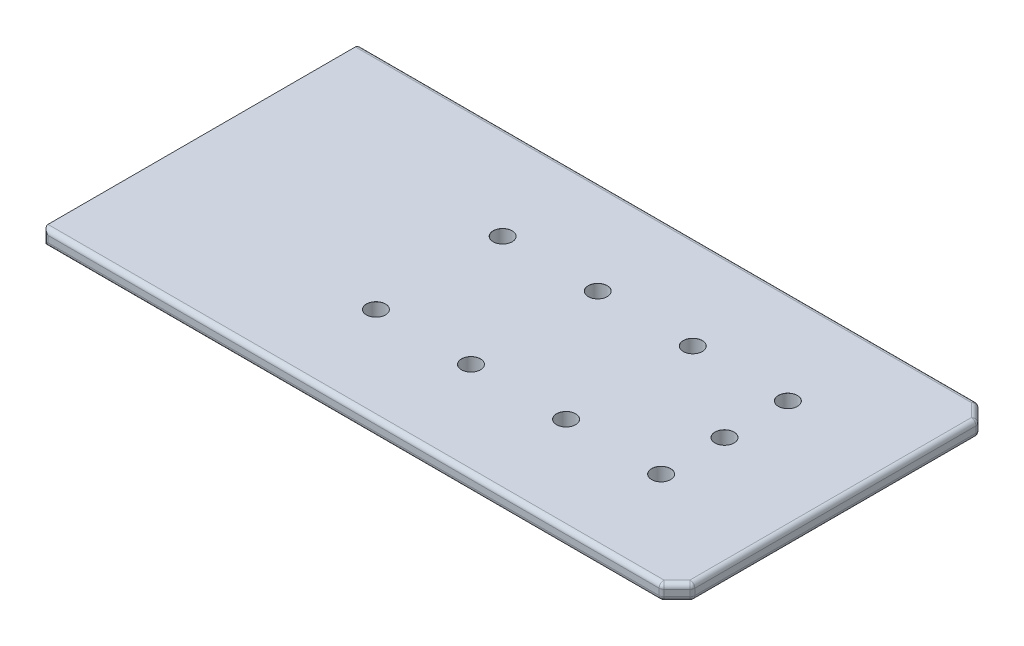
from build123d import *

# Parameters (mm, degrees)
SKETCH1_W                       = 400
SKETCH1_H                       = 200
BASE_FLANGE1_DEPTH              = 10
BREAK_CORNER1_DEPTH             = 10
M10_CLEARANCE_HOLE1_D           = 12
M10_CLEARANCE_HOLE1_CSINK_D     = 12.05
M10_CLEARANCE_HOLE1_CSINK_ANGLE = 90
FILLET1_R                       = 3


# Read off the part's stored shape, not the designer's step: Break-Corner1
# Sheet-metal steps are written as plain solids
with BuildPart() as part:
    # Sketch1 → Base-Flange1 (new body)
    with BuildSketch(Plane(origin=(0, 0, 0), x_dir=(1, 0, 0), z_dir=(0, 1, 0))):
        Rectangle(SKETCH1_W, SKETCH1_H)
    extrude(amount=BASE_FLANGE1_DEPTH)

    # Break-Corner1 outline → Break-Corner1 (cut)
    with BuildSketch(Plane(origin=(0, 0, 0), x_dir=(1, 0, 0), z_dir=(0, 1, 0))):
        Polygon((200, -100), (200, -90), (190, -100), align=None)
        Polygon((190, 100), (200, 90), (200, 100), align=None)
    extrude(amount=BREAK_CORNER1_DEPTH, mode=Mode.SUBTRACT)

    # M10 Clearance Hole1 (through all)
    with Locations(Plane(origin=(0, 10, 0), x_dir=(1, 0, 0), z_dir=(0, 1, 0))):
        with Locations((-50, 40), (10, 40), (70, 40), (130, 40), (130, 0), (130, -40), (70, -40), (10, -40), (-50, -40)):
            CounterSinkHole(M10_CLEARANCE_HOLE1_D / 2, M10_CLEARANCE_HOLE1_CSINK_D / 2, counter_sink_angle=M10_CLEARANCE_HOLE1_CSINK_ANGLE)

    # Fillet1
    fillet1_edges = [part.edges().sort_by_distance(p)[0] for p in [
        (200, 0, 0),
        (200, 10, 0),
        (200, 5, 90),
        (195, 0, 95),
        (190, 5, 100),
        (195, 10, 95),
        (-5, 0, -100),
        (-5, 10, -100),
        (190, 5, -100),
        (195, 0, -95),
        (200, 5, -90),
        (195, 10, -95),
        (-5, 0, 100),
        (-200, 5, -100),
        (-200, 5, 100),
        (-5, 10, 100),
    ]]
    fillet(fillet1_edges, radius=FILLET1_R)


solid = part.part
